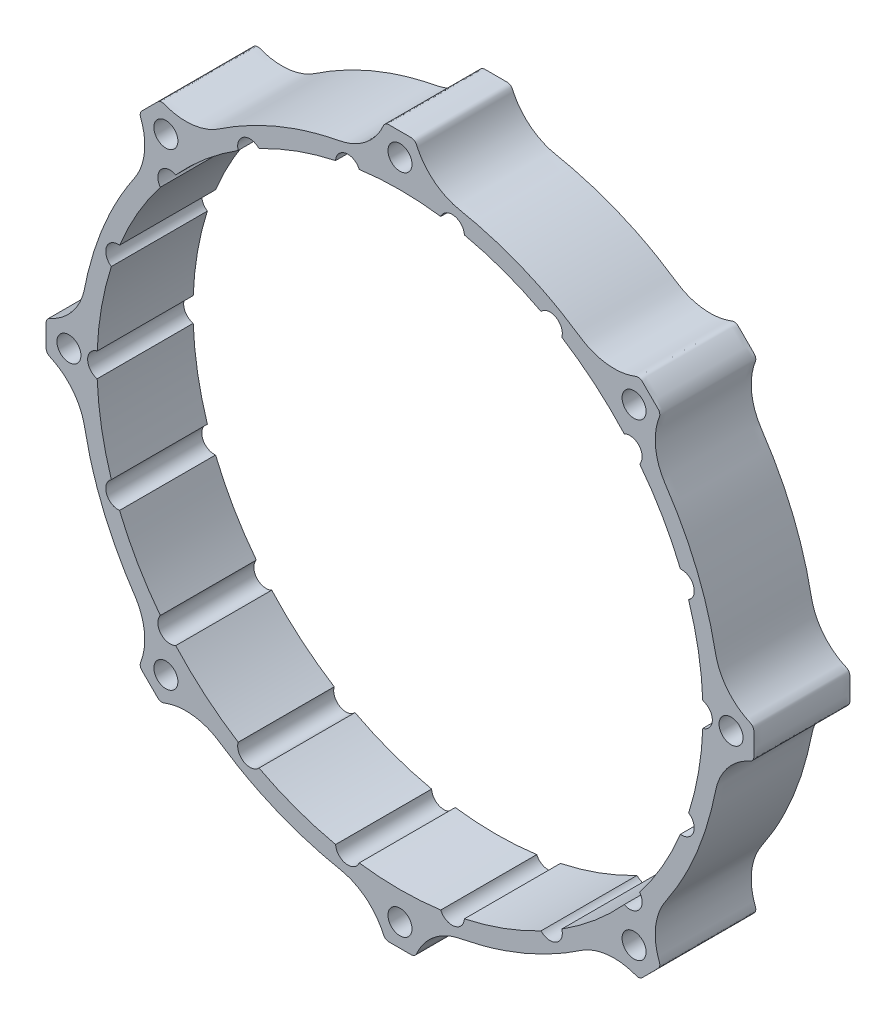
from build123d import *

# Parameters (mm, degrees)
BOSS_EXTRUDE1_DEPTH             = 16
F_4_0MM_DOWEL_HOLE1_D           = 4
F_4_0MM_DOWEL_HOLE1_CSINK_D     = 4.05
F_4_0MM_DOWEL_HOLE1_CSINK_ANGLE = 90
CIRPATTERN1_COUNT               = 8


with BuildPart() as part:
    # Sketch1 → Boss-Extrude1 (new body)
    with BuildSketch(Plane.XY):
        with BuildLine():
            add(Edge.make_bspline(
                [(2.888569338, 58.090305414), (2.86043616, 58.149718786), (2.805341513, 58.269100351), (2.727304111, 58.453248868), (2.652227716, 58.561956296), (2.609742987, 58.612120747), (2.483296792, 58.761423899), (2.319504695, 58.868438946), (2.131986062, 58.924267553), (2.101278346, 58.933409946), (2.038984153, 58.948743127), (1.942760285, 58.965842714), (1.878680735, 58.965842714), (1.84664096, 58.965842714), (1.814601185, 58.965842714), (1.750521635, 58.965842714), (1.654402311, 58.965842714), (1.590322761, 58.965842714), (1.558282986, 58.965842714), (0.519427662, 58.965842714), (-0.519427662, 58.965842714), (-1.558282986, 58.965842714), (-1.590322761, 58.965842714), (-1.654402311, 58.965842714), (-1.750521635, 58.965842714), (-1.814601185, 58.965842714), (-1.84664096, 58.965842714), (-1.878680735, 58.965842714), (-1.942760285, 58.965842714), (-2.038984153, 58.948743127), (-2.101278346, 58.933409946), (-2.131986062, 58.924267553), (-2.319504695, 58.868438946), (-2.483296792, 58.761423899), (-2.609742987, 58.612120747), (-2.652227716, 58.561956296), (-2.727304111, 58.453248868), (-2.805341513, 58.269100351), (-2.86043616, 58.149718786), (-2.888569338, 58.090305414), (-3.904277799, 55.9452699), (-5.591838924, 54.27644442), (-7.748079959, 53.284746062), (-8.235225684, 53.060698004), (-9.245557382, 52.690963884), (-10.84227328, 52.398071486), (-11.889156148, 52.164983222), (-12.410727624, 52.040597997), (-17.936005436, 50.722920633), (-23.183850069, 48.549192213), (-28.022550078, 45.573969403), (-28.479310442, 45.293116312), (-29.384386709, 44.717676629), (-30.720541549, 43.79573419), (-31.696395448, 43.342763299), (-32.199285394, 43.156725154), (-34.52028494, 42.298099023), (-36.994919588, 42.319571853), (-39.300669877, 43.218345087), (-39.301071956, 43.218501816), (-39.301876093, 43.218815326), (-39.303082259, 43.219285695), (-39.303886294, 43.219599465), (-39.304288312, 43.21975635), (-39.304689349, 43.219912852), (-39.305491422, 43.220225856), (-39.306694532, 43.220695362), (-39.307496605, 43.221008367), (-39.307897642, 43.221164869), (-39.310303861, 43.222103881), (-39.31271008, 43.223042894), (-39.3151163, 43.223981906), (-39.315517337, 43.224138408), (-39.31631941, 43.224451412), (-39.317522519, 43.224920919), (-39.318324593, 43.225233923), (-39.318725629, 43.225390425), (-39.319128068, 43.225547474), (-39.319932946, 43.225861573), (-39.321141382, 43.226329852), (-39.321947274, 43.226641342), (-39.32235032, 43.226796825), (-39.599832465, 43.333841276), (-39.896638588, 43.314841774), (-40.158207362, 43.173290965), (-40.186385644, 43.158041979), (-40.241276486, 43.124835529), (-40.32140827, 43.068886213), (-40.366719354, 43.023575129), (-40.389374896, 43.000919586), (-40.412030438, 42.978264044), (-40.457341522, 42.93295296), (-40.525308148, 42.864986334), (-40.570619233, 42.81967525), (-40.593274775, 42.797019708), (-41.327856419, 42.062438063), (-42.062438063, 41.327856419), (-42.797019708, 40.593274775), (-42.81967525, 40.570619233), (-42.864986334, 40.525308148), (-42.93295296, 40.457341522), (-42.978264044, 40.412030438), (-43.000919586, 40.389374896), (-43.023575129, 40.366719354), (-43.068886213, 40.32140827), (-43.124835529, 40.241276486), (-43.158041979, 40.186385644), (-43.173290965, 40.158207362), (-43.314841774, 39.896638588), (-43.333841276, 39.599832465), (-43.226796825, 39.32235032), (-43.226641342, 39.321947274), (-43.226329852, 39.321141382), (-43.225861573, 39.319932946), (-43.225547474, 39.319128068), (-43.225390425, 39.318725629), (-43.225233923, 39.318324593), (-43.224920919, 39.317522519), (-43.224451412, 39.31631941), (-43.224138408, 39.315517337), (-43.223981906, 39.3151163), (-43.223042894, 39.31271008), (-43.222103881, 39.310303861), (-43.221164869, 39.307897642), (-43.221008367, 39.307496605), (-43.220695362, 39.306694532), (-43.220225856, 39.305491422), (-43.219912852, 39.304689349), (-43.21975635, 39.304288312), (-43.219599465, 39.303886294), (-43.219285695, 39.303082259), (-43.218815326, 39.301876093), (-43.218501816, 39.301071956), (-43.218345087, 39.300669877), (-42.319571853, 36.994919588), (-42.298099023, 34.52028494), (-43.156725154, 32.199285394), (-43.342763299, 31.696395448), (-43.79573419, 30.720541549), (-44.717676629, 29.384386709), (-45.293116312, 28.479310442), (-45.573969403, 28.022550078), (-48.549192213, 23.183850069), (-50.722920633, 17.936005436), (-52.040597997, 12.410727624), (-52.164983222, 11.889156148), (-52.398071486, 10.84227328), (-52.690963884, 9.245557382), (-53.060698004, 8.235225684), (-53.284746062, 7.748079959), (-54.31880022, 5.499745081), (-56.083814744, 3.765097724), (-58.349755058, 2.770214708), (-58.350150195, 2.770041219), (-58.350940491, 2.769694293), (-58.35212598, 2.769174006), (-58.352916388, 2.768827336), (-58.353311592, 2.768654001), (-58.353705831, 2.768481089), (-58.35449431, 2.768135265), (-58.355677028, 2.767616529), (-58.356465507, 2.767270705), (-58.356859746, 2.767097793), (-58.359225182, 2.766060321), (-58.361590618, 2.765022849), (-58.363956055, 2.763985377), (-58.364350294, 2.763812465), (-58.365138773, 2.763466641), (-58.366321491, 2.762947905), (-58.367109969, 2.762602081), (-58.367504209, 2.762429169), (-58.367899827, 2.762255652), (-58.368691063, 2.761908619), (-58.36987668, 2.761385249), (-58.370666787, 2.761035654), (-58.371061728, 2.7608606), (-58.642963091, 2.640342951), (-58.839402036, 2.417034653), (-58.924267553, 2.131986062), (-58.933409946, 2.101278346), (-58.948743127, 2.038984153), (-58.965842714, 1.942760285), (-58.965842714, 1.878680735), (-58.965842714, 1.84664096), (-58.965842714, 1.814601185), (-58.965842714, 1.750521635), (-58.965842714, 1.654402311), (-58.965842714, 1.590322761), (-58.965842714, 1.558282986), (-58.965842714, 0.519427662), (-58.965842714, -0.519427662), (-58.965842714, -1.558282986), (-58.965842714, -1.590322761), (-58.965842714, -1.654402311), (-58.965842714, -1.750521635), (-58.965842714, -1.814601185), (-58.965842714, -1.84664096), (-58.965842714, -1.878680735), (-58.965842714, -1.942760285), (-58.948743127, -2.038984153), (-58.933409946, -2.101278346), (-58.924267553, -2.131986062), (-58.839402036, -2.417034653), (-58.642963091, -2.640342951), (-58.371061728, -2.7608606), (-58.370666787, -2.761035654), (-58.36987668, -2.761385249), (-58.368691063, -2.761908619), (-58.367899827, -2.762255652), (-58.367504209, -2.762429169), (-58.367109969, -2.762602081), (-58.366321491, -2.762947905), (-58.365138773, -2.763466641), (-58.364350294, -2.763812465), (-58.363956055, -2.763985377), (-58.361590618, -2.765022849), (-58.359225182, -2.766060321), (-58.356859746, -2.767097793), (-58.356465507, -2.767270705), (-58.355677028, -2.767616529), (-58.35449431, -2.768135265), (-58.353705831, -2.768481089), (-58.353311592, -2.768654001), (-58.352916388, -2.768827336), (-58.35212598, -2.769174006), (-58.350940491, -2.769694293), (-58.350150195, -2.770041219), (-58.349755058, -2.770214708), (-56.083814744, -3.765097724), (-54.31880022, -5.499745081), (-53.284746062, -7.748079959), (-53.060698004, -8.235225684), (-52.690963884, -9.245557382), (-52.398071486, -10.84227328), (-52.164983222, -11.889156148), (-52.040597997, -12.410727624), (-50.722920633, -17.936005436), (-48.549192213, -23.183850069), (-45.573969403, -28.022550078), (-45.293116312, -28.479310442), (-44.717676629, -29.384386709), (-43.79573419, -30.720541549), (-43.342763299, -31.696395448), (-43.156725154, -32.199285394), (-42.298099023, -34.52028494), (-42.319571853, -36.994919588), (-43.218345087, -39.300669877), (-43.218501816, -39.301071956), (-43.218815326, -39.301876093), (-43.219285695, -39.303082259), (-43.219599465, -39.303886294), (-43.21975635, -39.304288312), (-43.219912852, -39.304689349), (-43.220225856, -39.305491422), (-43.220695362, -39.306694532), (-43.221008367, -39.307496605), (-43.221164869, -39.307897642), (-43.222103881, -39.310303861), (-43.223042894, -39.31271008), (-43.223981906, -39.3151163), (-43.224138408, -39.315517337), (-43.224451412, -39.31631941), (-43.224920919, -39.317522519), (-43.225233923, -39.318324593), (-43.225390425, -39.318725629), (-43.225547474, -39.319128068), (-43.225861573, -39.319932946), (-43.226329852, -39.321141382), (-43.226641342, -39.321947274), (-43.226796825, -39.32235032), (-43.333841276, -39.599832465), (-43.314841774, -39.896638588), (-43.173290965, -40.158207362), (-43.158041979, -40.186385644), (-43.124835529, -40.241276486), (-43.068886213, -40.32140827), (-43.023575129, -40.366719354), (-43.000919586, -40.389374896), (-42.978264044, -40.412030438), (-42.93295296, -40.457341522), (-42.864986334, -40.525308148), (-42.81967525, -40.570619233), (-42.797019708, -40.593274775), (-42.062438063, -41.327856419), (-41.327856419, -42.062438063), (-40.593274775, -42.797019708), (-40.570619233, -42.81967525), (-40.525308148, -42.864986334), (-40.457341522, -42.93295296), (-40.412030438, -42.978264044), (-40.389374896, -43.000919586), (-40.366719354, -43.023575129), (-40.32140827, -43.068886213), (-40.241276486, -43.124835529), (-40.186385644, -43.158041979), (-40.158207362, -43.173290965), (-39.896638588, -43.314841774), (-39.599832465, -43.333841276), (-39.32235032, -43.226796825), (-39.321947274, -43.226641342), (-39.321141382, -43.226329852), (-39.319932946, -43.225861573), (-39.319128068, -43.225547474), (-39.318725629, -43.225390425), (-39.318324593, -43.225233923), (-39.317522519, -43.224920919), (-39.31631941, -43.224451412), (-39.315517337, -43.224138408), (-39.3151163, -43.223981906), (-39.31271008, -43.223042894), (-39.310303861, -43.222103881), (-39.307897642, -43.221164869), (-39.307496605, -43.221008367), (-39.306694532, -43.220695362), (-39.305491422, -43.220225856), (-39.304689349, -43.219912852), (-39.304288312, -43.21975635), (-39.303886294, -43.219599465), (-39.303082259, -43.219285695), (-39.301876093, -43.218815326), (-39.301071956, -43.218501816), (-39.300669877, -43.218345087), (-36.994919588, -42.319571853), (-34.52028494, -42.298099023), (-32.199285394, -43.156725154), (-31.696395448, -43.342763299), (-30.720541549, -43.79573419), (-29.384386709, -44.717676629), (-28.479310442, -45.293116312), (-28.022550078, -45.573969403), (-23.183850069, -48.549192213), (-17.936005436, -50.722920633), (-12.410727624, -52.040597997), (-11.889156148, -52.164983222), (-10.84227328, -52.398071486), (-9.245557382, -52.690963884), (-8.235225684, -53.060698004), (-7.748079959, -53.284746062), (-5.499745081, -54.31880022), (-3.765097724, -56.083814744), (-2.770214708, -58.349755058), (-2.770041219, -58.350150195), (-2.769694293, -58.350940491), (-2.769174006, -58.35212598), (-2.768827336, -58.352916388), (-2.768654001, -58.353311592), (-2.768481089, -58.353705831), (-2.768135265, -58.35449431), (-2.767616529, -58.355677028), (-2.767270705, -58.356465507), (-2.767097793, -58.356859746), (-2.766060321, -58.359225182), (-2.765022849, -58.361590618), (-2.763985377, -58.363956055), (-2.763812465, -58.364350294), (-2.763466641, -58.365138773), (-2.762947905, -58.366321491), (-2.762602081, -58.367109969), (-2.762429169, -58.367504209), (-2.762255652, -58.367899827), (-2.761908619, -58.368691063), (-2.761385249, -58.36987668), (-2.761035654, -58.370666787), (-2.7608606, -58.371061728), (-2.640342951, -58.642963091), (-2.417034653, -58.839402036), (-2.131986062, -58.924267553), (-2.101278346, -58.933409946), (-2.038984153, -58.948743127), (-1.942760285, -58.965842714), (-1.878680735, -58.965842714), (-1.84664096, -58.965842714), (-1.814601185, -58.965842714), (-1.750521635, -58.965842714), (-1.654402311, -58.965842714), (-1.590322761, -58.965842714), (-1.558282986, -58.965842714), (-0.519427662, -58.965842714), (0.519427662, -58.965842714), (1.558282986, -58.965842714), (1.590322761, -58.965842714), (1.654402311, -58.965842714), (1.750521635, -58.965842714), (1.814601185, -58.965842714), (1.84664096, -58.965842714), (1.878680735, -58.965842714), (1.942760285, -58.965842714), (2.038984153, -58.948743127), (2.101278346, -58.933409946), (2.131986062, -58.924267553), (2.417034653, -58.839402036), (2.640342951, -58.642963091), (2.7608606, -58.371061728), (2.761035654, -58.370666787), (2.761385249, -58.36987668), (2.761908619, -58.368691063), (2.762255652, -58.367899827), (2.762429169, -58.367504209), (2.762602081, -58.367109969), (2.762947905, -58.366321491), (2.763466641, -58.365138773), (2.763812465, -58.364350294), (2.763985377, -58.363956055), (2.765022849, -58.361590618), (2.766060321, -58.359225182), (2.767097793, -58.356859746), (2.767270705, -58.356465507), (2.767616529, -58.355677028), (2.768135265, -58.35449431), (2.768481089, -58.353705831), (2.768654001, -58.353311592), (2.768827336, -58.352916388), (2.769174006, -58.35212598), (2.769694293, -58.350940491), (2.770041219, -58.350150195), (2.770214708, -58.349755058), (3.765097724, -56.083814744), (5.499745081, -54.31880022), (7.748079959, -53.284746062), (8.235225684, -53.060698004), (9.245557382, -52.690963884), (10.84227328, -52.398071486), (11.889156148, -52.164983222), (12.410727624, -52.040597997), (17.936005436, -50.722920633), (23.183850069, -48.549192213), (28.022550078, -45.573969403), (28.479310442, -45.293116312), (29.384386709, -44.717676629), (30.720541549, -43.79573419), (31.696395448, -43.342763299), (32.199285394, -43.156725154), (34.52028494, -42.298099023), (36.994919588, -42.319571853), (39.300669877, -43.218345087), (39.301071956, -43.218501816), (39.301876093, -43.218815326), (39.303082259, -43.219285695), (39.303886294, -43.219599465), (39.304288312, -43.21975635), (39.304689349, -43.219912852), (39.305491422, -43.220225856), (39.306694532, -43.220695362), (39.307496605, -43.221008367), (39.307897642, -43.221164869), (39.310303861, -43.222103881), (39.31271008, -43.223042894), (39.3151163, -43.223981906), (39.315517337, -43.224138408), (39.31631941, -43.224451412), (39.317522519, -43.224920919), (39.318324593, -43.225233923), (39.318725629, -43.225390425), (39.319128068, -43.225547474), (39.319932946, -43.225861573), (39.321141382, -43.226329852), (39.321947274, -43.226641342), (39.32235032, -43.226796825), (39.599832465, -43.333841276), (39.896638588, -43.314841774), (40.158207362, -43.173290965), (40.186385644, -43.158041979), (40.241276486, -43.124835529), (40.32140827, -43.068886213), (40.366719354, -43.023575129), (40.389374896, -43.000919586), (40.412030438, -42.978264044), (40.457341522, -42.93295296), (40.525308148, -42.864986334), (40.570619233, -42.81967525), (40.593274775, -42.797019708), (41.327856419, -42.062438063), (42.062438063, -41.327856419), (42.797019708, -40.593274775), (42.81967525, -40.570619233), (42.864986334, -40.525308148), (42.93295296, -40.457341522), (42.978264044, -40.412030438), (43.000919586, -40.389374896), (43.023575129, -40.366719354), (43.068886213, -40.32140827), (43.124835529, -40.241276486), (43.158041979, -40.186385644), (43.173290965, -40.158207362), (43.314841774, -39.896638588), (43.333841276, -39.599832465), (43.226796825, -39.32235032), (43.226641342, -39.321947274), (43.226329852, -39.321141382), (43.225861573, -39.319932946), (43.225547474, -39.319128068), (43.225390425, -39.318725629), (43.225233923, -39.318324593), (43.224920919, -39.317522519), (43.224451412, -39.31631941), (43.224138408, -39.315517337), (43.223981906, -39.3151163), (43.223042894, -39.31271008), (43.222103881, -39.310303861), (43.221164869, -39.307897642), (43.221008367, -39.307496605), (43.220695362, -39.306694532), (43.220225856, -39.305491422), (43.219912852, -39.304689349), (43.21975635, -39.304288312), (43.219599465, -39.303886294), (43.219285695, -39.303082259), (43.218815326, -39.301876093), (43.218501816, -39.301071956), (43.218345087, -39.300669877), (42.319571853, -36.994919588), (42.298099023, -34.52028494), (43.156725154, -32.199285394), (43.342763299, -31.696395448), (43.79573419, -30.720541549), (44.717676629, -29.384386709), (45.293116312, -28.479310442), (45.573969403, -28.022550078), (48.549192213, -23.183850069), (50.722920633, -17.936005436), (52.040597997, -12.410727624), (52.164983222, -11.889156148), (52.398071486, -10.84227328), (52.690963884, -9.245557382), (53.060698004, -8.235225684), (53.284746062, -7.748079959), (54.31880022, -5.499745081), (56.083814744, -3.765097724), (58.349755058, -2.770214708), (58.350150195, -2.770041219), (58.350940491, -2.769694293), (58.35212598, -2.769174006), (58.352916388, -2.768827336), (58.353311592, -2.768654001), (58.353705831, -2.768481089), (58.35449431, -2.768135265), (58.355677028, -2.767616529), (58.356465507, -2.767270705), (58.356859746, -2.767097793), (58.359225182, -2.766060321), (58.361590618, -2.765022849), (58.363956055, -2.763985377), (58.364350294, -2.763812465), (58.365138773, -2.763466641), (58.366321491, -2.762947905), (58.367109969, -2.762602081), (58.367504209, -2.762429169), (58.367899827, -2.762255652), (58.368691063, -2.761908619), (58.36987668, -2.761385249), (58.370666787, -2.761035654), (58.371061728, -2.7608606), (58.642963091, -2.640342951), (58.839402036, -2.417034653), (58.924267553, -2.131986062), (58.933409946, -2.101278346), (58.948743127, -2.038984153), (58.965842714, -1.942760285), (58.965842714, -1.878680735), (58.965842714, -1.84664096), (58.965842714, -1.814601185), (58.965842714, -1.750521635), (58.965842714, -1.654402311), (58.965842714, -1.590322761), (58.965842714, -1.558282986), (58.965842714, -0.519427662), (58.965842714, 0.519427662), (58.965842714, 1.558282986), (58.965842714, 1.590322761), (58.965842714, 1.654402311), (58.965842714, 1.750521635), (58.965842714, 1.814601185), (58.965842714, 1.84664096), (58.965842714, 1.878680735), (58.965842714, 1.942760285), (58.948743127, 2.038984153), (58.933409946, 2.101278346), (58.924267553, 2.131986062), (58.839402036, 2.417034653), (58.642963091, 2.640342951), (58.371061728, 2.7608606), (58.370666787, 2.761035654), (58.36987668, 2.761385249), (58.368691063, 2.761908619), (58.367899827, 2.762255652), (58.367504209, 2.762429169), (58.367109969, 2.762602081), (58.366321491, 2.762947905), (58.365138773, 2.763466641), (58.364350294, 2.763812465), (58.363956055, 2.763985377), (58.361590618, 2.765022849), (58.359225182, 2.766060321), (58.356859746, 2.767097793), (58.356465507, 2.767270705), (58.355677028, 2.767616529), (58.35449431, 2.768135265), (58.353705831, 2.768481089), (58.353311592, 2.768654001), (58.352916388, 2.768827336), (58.35212598, 2.769174006), (58.350940491, 2.769694293), (58.350150195, 2.770041219), (58.349755058, 2.770214708), (56.083814744, 3.765097724), (54.31880022, 5.499745081), (53.284746062, 7.748079959), (53.060698004, 8.235225684), (52.690963884, 9.245557382), (52.398071486, 10.84227328), (52.164983222, 11.889156148), (52.040597997, 12.410727624), (50.722920633, 17.936005436), (48.549192213, 23.183850069), (45.573969403, 28.022550078), (45.293116312, 28.479310442), (44.717676629, 29.384386709), (43.79573419, 30.720541549), (43.342763299, 31.696395448), (43.156725154, 32.199285394), (42.298099023, 34.52028494), (42.319571853, 36.994919588), (43.218345087, 39.300669877), (43.218501816, 39.301071956), (43.218815326, 39.301876093), (43.219285695, 39.303082259), (43.219599465, 39.303886294), (43.21975635, 39.304288312), (43.219912852, 39.304689349), (43.220225856, 39.305491422), (43.220695362, 39.306694532), (43.221008367, 39.307496605), (43.221164869, 39.307897642), (43.222103881, 39.310303861), (43.223042894, 39.31271008), (43.223981906, 39.3151163), (43.224138408, 39.315517337), (43.224451412, 39.31631941), (43.224920919, 39.317522519), (43.225233923, 39.318324593), (43.225390425, 39.318725629), (43.225547474, 39.319128068), (43.225861573, 39.319932946), (43.226329852, 39.321141382), (43.226641342, 39.321947274), (43.226796825, 39.32235032), (43.333841276, 39.599832465), (43.314841774, 39.896638588), (43.173290965, 40.158207362), (43.158041979, 40.186385644), (43.124835529, 40.241276486), (43.068886213, 40.32140827), (43.023575129, 40.366719354), (43.000919586, 40.389374896), (42.978264044, 40.412030438), (42.93295296, 40.457341522), (42.864986334, 40.525308148), (42.81967525, 40.570619233), (42.797019708, 40.593274775), (42.062438063, 41.327856419), (41.327856419, 42.062438063), (40.593274775, 42.797019708), (40.570619233, 42.81967525), (40.525308148, 42.864986334), (40.457341522, 42.93295296), (40.412030438, 42.978264044), (40.389374896, 43.000919586), (40.366719354, 43.023575129), (40.32140827, 43.068886213), (40.241276486, 43.124835529), (40.186385644, 43.158041979), (40.158207362, 43.173290965), (39.896638588, 43.314841774), (39.599832465, 43.333841276), (39.32235032, 43.226796825), (39.321947274, 43.226641342), (39.321141382, 43.226329852), (39.319932946, 43.225861573), (39.319128068, 43.225547474), (39.318725629, 43.225390425), (39.318324593, 43.225233923), (39.317522519, 43.224920919), (39.31631941, 43.224451412), (39.315517337, 43.224138408), (39.3151163, 43.223981906), (39.31271008, 43.223042894), (39.310303861, 43.222103881), (39.307897642, 43.221164869), (39.307496605, 43.221008367), (39.306694532, 43.220695362), (39.305491422, 43.220225856), (39.304689349, 43.219912852), (39.304288312, 43.21975635), (39.303886295, 43.219599465), (39.303082259, 43.219285695), (39.301876093, 43.218815326), (39.301071956, 43.218501816), (39.300669877, 43.218345087), (36.994919588, 42.319571853), (34.52028494, 42.298099023), (32.199285394, 43.156725154), (31.696395448, 43.342763299), (30.720541549, 43.79573419), (29.384386709, 44.717676629), (28.479310442, 45.293116312), (28.022550078, 45.573969403), (23.183850069, 48.549192213), (17.936005436, 50.722920633), (12.410727624, 52.040597997), (11.889156148, 52.164983222), (10.84227328, 52.398071486), (9.245557382, 52.690963884), (8.235225684, 53.060698004), (7.748079959, 53.284746062), (5.591838924, 54.27644442), (3.904277799, 55.9452699), (2.888569338, 58.090305414)],
                knots=[0, 0, 0, 0, 0.00052727, 0.001054541, 0.001581811, 0.001581811, 0.001581811, 0.003107616, 0.003107616, 0.003107616, 0.003364602, 0.003621588, 0.003878574, 0.003878574, 0.003878574, 0.00413556, 0.004392546, 0.004649532, 0.004649532, 0.004649532, 0.012982025, 0.012982025, 0.012982025, 0.013239011, 0.013495997, 0.013752983, 0.013752983, 0.013752983, 0.014009968, 0.014266954, 0.01452394, 0.01452394, 0.01452394, 0.016049745, 0.016049745, 0.016049745, 0.016577016, 0.017104286, 0.017631556, 0.017631556, 0.017631556, 0.035903949, 0.035903949, 0.035903949, 0.040204709, 0.044505469, 0.048806229, 0.048806229, 0.048806229, 0.093985258, 0.093985258, 0.093985258, 0.098286018, 0.102586778, 0.106887539, 0.106887539, 0.106887539, 0.125874611, 0.125874611, 0.125874611, 0.125878073, 0.125881534, 0.125884995, 0.125884995, 0.125884995, 0.125888448, 0.125891901, 0.125895354, 0.125895354, 0.125895354, 0.125916072, 0.125916072, 0.125916072, 0.125919524, 0.125922977, 0.12592643, 0.12592643, 0.12592643, 0.125929895, 0.12593336, 0.125936825, 0.125936825, 0.125936825, 0.128176158, 0.128176158, 0.128176158, 0.128433144, 0.12869013, 0.128947116, 0.128947116, 0.128947116, 0.129204102, 0.129461088, 0.129718073, 0.129718073, 0.129718073, 0.138050566, 0.138050566, 0.138050566, 0.138307552, 0.138564538, 0.138821524, 0.138821524, 0.138821524, 0.13907851, 0.139335496, 0.139592482, 0.139592482, 0.139592482, 0.141831815, 0.141831815, 0.141831815, 0.14183528, 0.141838745, 0.14184221, 0.14184221, 0.14184221, 0.141845663, 0.141849116, 0.141852568, 0.141852568, 0.141852568, 0.141873286, 0.141873286, 0.141873286, 0.141876739, 0.141880192, 0.141883645, 0.141883645, 0.141883645, 0.141887106, 0.141890567, 0.141894029, 0.141894029, 0.141894029, 0.160881101, 0.160881101, 0.160881101, 0.165181861, 0.169482622, 0.173783382, 0.173783382, 0.173783382, 0.218962411, 0.218962411, 0.218962411, 0.223263171, 0.227563931, 0.231864691, 0.231864691, 0.231864691, 0.250851764, 0.250851764, 0.250851764, 0.250855225, 0.250858687, 0.250862148, 0.250862148, 0.250862148, 0.250865601, 0.250869054, 0.250872507, 0.250872507, 0.250872507, 0.250893224, 0.250893224, 0.250893224, 0.250896677, 0.25090013, 0.250903583, 0.250903583, 0.250903583, 0.250907048, 0.250910513, 0.250913978, 0.250913978, 0.250913978, 0.253153311, 0.253153311, 0.253153311, 0.253410297, 0.253667282, 0.253924268, 0.253924268, 0.253924268, 0.254181254, 0.25443824, 0.254695226, 0.254695226, 0.254695226, 0.263027719, 0.263027719, 0.263027719, 0.263284705, 0.263541691, 0.263798677, 0.263798677, 0.263798677, 0.264055663, 0.264312649, 0.264569635, 0.264569635, 0.264569635, 0.266808968, 0.266808968, 0.266808968, 0.266812433, 0.266815897, 0.266819362, 0.266819362, 0.266819362, 0.266822815, 0.266826268, 0.266829721, 0.266829721, 0.266829721, 0.266850439, 0.266850439, 0.266850439, 0.266853892, 0.266857344, 0.266860797, 0.266860797, 0.266860797, 0.266864259, 0.26686772, 0.266871181, 0.266871181, 0.266871181, 0.285858254, 0.285858254, 0.285858254, 0.290159014, 0.294459774, 0.298760535, 0.298760535, 0.298760535, 0.343939564, 0.343939564, 0.343939564, 0.348240324, 0.352541084, 0.356841844, 0.356841844, 0.356841844, 0.375828917, 0.375828917, 0.375828917, 0.375832378, 0.375835839, 0.375839301, 0.375839301, 0.375839301, 0.375842754, 0.375846207, 0.37584966, 0.37584966, 0.37584966, 0.375870377, 0.375870377, 0.375870377, 0.37587383, 0.375877283, 0.375880736, 0.375880736, 0.375880736, 0.375884201, 0.375887666, 0.375891131, 0.375891131, 0.375891131, 0.378130463, 0.378130463, 0.378130463, 0.378387449, 0.378644435, 0.378901421, 0.378901421, 0.378901421, 0.379158407, 0.379415393, 0.379672379, 0.379672379, 0.379672379, 0.388004872, 0.388004872, 0.388004872, 0.388261858, 0.388518844, 0.38877583, 0.38877583, 0.38877583, 0.389032816, 0.389289802, 0.389546788, 0.389546788, 0.389546788, 0.39178612, 0.39178612, 0.39178612, 0.391789585, 0.39179305, 0.391796515, 0.391796515, 0.391796515, 0.391799968, 0.391803421, 0.391806874, 0.391806874, 0.391806874, 0.391827591, 0.391827591, 0.391827591, 0.391831044, 0.391834497, 0.39183795, 0.39183795, 0.39183795, 0.391841411, 0.391844873, 0.391848334, 0.391848334, 0.391848334, 0.410835407, 0.410835407, 0.410835407, 0.415136167, 0.419436927, 0.423737687, 0.423737687, 0.423737687, 0.468916716, 0.468916716, 0.468916716, 0.473217477, 0.477518237, 0.481818997, 0.481818997, 0.481818997, 0.50080607, 0.50080607, 0.50080607, 0.500809531, 0.500812992, 0.500816454, 0.500816454, 0.500816454, 0.500819906, 0.500823359, 0.500826812, 0.500826812, 0.500826812, 0.50084753, 0.50084753, 0.50084753, 0.500850983, 0.500854436, 0.500857888, 0.500857888, 0.500857888, 0.500861353, 0.500864818, 0.500868283, 0.500868283, 0.500868283, 0.503107616, 0.503107616, 0.503107616, 0.503364602, 0.503621588, 0.503878574, 0.503878574, 0.503878574, 0.50413556, 0.504392546, 0.504649532, 0.504649532, 0.504649532, 0.512982025, 0.512982025, 0.512982025, 0.513239011, 0.513495997, 0.513752983, 0.513752983, 0.513752983, 0.514009968, 0.514266954, 0.51452394, 0.51452394, 0.51452394, 0.516763273, 0.516763273, 0.516763273, 0.516766738, 0.516770203, 0.516773668, 0.516773668, 0.516773668, 0.516777121, 0.516780574, 0.516784027, 0.516784027, 0.516784027, 0.516804744, 0.516804744, 0.516804744, 0.516808197, 0.51681165, 0.516815103, 0.516815103, 0.516815103, 0.516818564, 0.516822026, 0.516825487, 0.516825487, 0.516825487, 0.53581256, 0.53581256, 0.53581256, 0.54011332, 0.54441408, 0.54871484, 0.54871484, 0.54871484, 0.593893869, 0.593893869, 0.593893869, 0.598194629, 0.602495389, 0.60679615, 0.60679615, 0.60679615, 0.625783222, 0.625783222, 0.625783222, 0.625786684, 0.625790145, 0.625793606, 0.625793606, 0.625793606, 0.625797059, 0.625800512, 0.625803965, 0.625803965, 0.625803965, 0.625824682, 0.625824682, 0.625824682, 0.625828135, 0.625831588, 0.625835041, 0.625835041, 0.625835041, 0.625838506, 0.625841971, 0.625845436, 0.625845436, 0.625845436, 0.628084769, 0.628084769, 0.628084769, 0.628341755, 0.628598741, 0.628855727, 0.628855727, 0.628855727, 0.629112713, 0.629369699, 0.629626684, 0.629626684, 0.629626684, 0.637959177, 0.637959177, 0.637959177, 0.638216163, 0.638473149, 0.638730135, 0.638730135, 0.638730135, 0.638987121, 0.639244107, 0.639501093, 0.639501093, 0.639501093, 0.641740426, 0.641740426, 0.641740426, 0.641743891, 0.641747356, 0.641750821, 0.641750821, 0.641750821, 0.641754274, 0.641757727, 0.641761179, 0.641761179, 0.641761179, 0.641781897, 0.641781897, 0.641781897, 0.64178535, 0.641788803, 0.641792256, 0.641792256, 0.641792256, 0.641795717, 0.641799178, 0.64180264, 0.64180264, 0.64180264, 0.660789712, 0.660789712, 0.660789712, 0.665090472, 0.669391233, 0.673691993, 0.673691993, 0.673691993, 0.718871022, 0.718871022, 0.718871022, 0.723171782, 0.727472542, 0.731773302, 0.731773302, 0.731773302, 0.750760375, 0.750760375, 0.750760375, 0.750763836, 0.750767298, 0.750770759, 0.750770759, 0.750770759, 0.750774212, 0.750777665, 0.750781118, 0.750781118, 0.750781118, 0.750801835, 0.750801835, 0.750801835, 0.750805288, 0.750808741, 0.750812194, 0.750812194, 0.750812194, 0.750815659, 0.750819124, 0.750822589, 0.750822589, 0.750822589, 0.753061922, 0.753061922, 0.753061922, 0.753318908, 0.753575893, 0.753832879, 0.753832879, 0.753832879, 0.754089865, 0.754346851, 0.754603837, 0.754603837, 0.754603837, 0.76293633, 0.76293633, 0.76293633, 0.763193316, 0.763450302, 0.763707288, 0.763707288, 0.763707288, 0.763964274, 0.76422126, 0.764478246, 0.764478246, 0.764478246, 0.766717579, 0.766717579, 0.766717579, 0.766721043, 0.766724508, 0.766727973, 0.766727973, 0.766727973, 0.766731426, 0.766734879, 0.766738332, 0.766738332, 0.766738332, 0.76675905, 0.76675905, 0.76675905, 0.766762503, 0.766765955, 0.766769408, 0.766769408, 0.766769408, 0.76677287, 0.766776331, 0.766779792, 0.766779792, 0.766779792, 0.785766865, 0.785766865, 0.785766865, 0.790067625, 0.794368385, 0.798669146, 0.798669146, 0.798669146, 0.843848175, 0.843848175, 0.843848175, 0.848148935, 0.852449695, 0.856750455, 0.856750455, 0.856750455, 0.875737528, 0.875737528, 0.875737528, 0.875740989, 0.87574445, 0.875747912, 0.875747912, 0.875747912, 0.875751365, 0.875754818, 0.875758271, 0.875758271, 0.875758271, 0.875778988, 0.875778988, 0.875778988, 0.875782441, 0.875785894, 0.875789347, 0.875789347, 0.875789347, 0.875792812, 0.875796277, 0.875799742, 0.875799742, 0.875799742, 0.878039074, 0.878039074, 0.878039074, 0.87829606, 0.878553046, 0.878810032, 0.878810032, 0.878810032, 0.879067018, 0.879324004, 0.87958099, 0.87958099, 0.87958099, 0.887913483, 0.887913483, 0.887913483, 0.888170469, 0.888427455, 0.888684441, 0.888684441, 0.888684441, 0.888941427, 0.889198413, 0.889455399, 0.889455399, 0.889455399, 0.891694731, 0.891694731, 0.891694731, 0.891698196, 0.891701661, 0.891705126, 0.891705126, 0.891705126, 0.891708579, 0.891712032, 0.891715485, 0.891715485, 0.891715485, 0.891736202, 0.891736202, 0.891736202, 0.891739655, 0.891743108, 0.891746561, 0.891746561, 0.891746561, 0.891750022, 0.891753484, 0.891756945, 0.891756945, 0.891756945, 0.910744018, 0.910744018, 0.910744018, 0.915044778, 0.919345538, 0.923646298, 0.923646298, 0.923646298, 0.968825327, 0.968825327, 0.968825327, 0.973126088, 0.977426848, 0.981727608, 0.981727608, 0.981727608, 1, 1, 1, 1], degree=3, weights=[1, 1, 1, 1, 1, 1, 0.972283226, 0.972283226, 1, 1, 1, 1, 1, 1, 1, 1, 1, 1, 1, 1, 1, 1, 1, 1, 1, 1, 1, 1, 1, 1, 1, 1, 0.972283226, 0.972283226, 1, 1, 1, 1, 1, 1, 0.959868564, 0.959868564, 1, 1, 1, 1, 1, 1, 0.991633934, 0.991633934, 1, 1, 1, 1, 1, 1, 0.956556623, 0.956556623, 1, 1, 1, 1, 1, 1, 1, 1, 1, 1, 1, 1, 1, 1, 1, 1, 1, 1, 1, 1, 1, 1, 1, 1, 0.938723945, 0.938723945, 1, 1, 1, 1, 1, 1, 1, 1, 1, 1, 1, 1, 1, 1, 1, 1, 1, 1, 1, 1, 1, 1, 1, 1, 0.938723945, 0.938723945, 1, 1, 1, 1, 1, 1, 1, 1, 1, 1, 1, 1, 1, 1, 1, 1, 1, 1, 1, 1, 1, 1, 1, 1, 0.956556623, 0.956556623, 1, 1, 1, 1, 1, 1, 0.991633934, 0.991633934, 1, 1, 1, 1, 1, 1, 0.956556623, 0.956556623, 1, 1, 1, 1, 1, 1, 1, 1, 1, 1, 1, 1, 1, 1, 1, 1, 1, 1, 1, 1, 1, 1, 1, 1, 0.938723945, 0.938723945, 1, 1, 1, 1, 1, 1, 1, 1, 1, 1, 1, 1, 1, 1, 1, 1, 1, 1, 1, 1, 1, 1, 1, 1, 0.938723945, 0.938723945, 1, 1, 1, 1, 1, 1, 1, 1, 1, 1, 1, 1, 1, 1, 1, 1, 1, 1, 1, 1, 1, 1, 1, 1, 0.956556623, 0.956556623, 1, 1, 1, 1, 1, 1, 0.991633934, 0.991633934, 1, 1, 1, 1, 1, 1, 0.956556623, 0.956556623, 1, 1, 1, 1, 1, 1, 1, 1, 1, 1, 1, 1, 1, 1, 1, 1, 1, 1, 1, 1, 1, 1, 1, 1, 0.938723945, 0.938723945, 1, 1, 1, 1, 1, 1, 1, 1, 1, 1, 1, 1, 1, 1, 1, 1, 1, 1, 1, 1, 1, 1, 1, 1, 0.938723945, 0.938723945, 1, 1, 1, 1, 1, 1, 1, 1, 1, 1, 1, 1, 1, 1, 1, 1, 1, 1, 1, 1, 1, 1, 1, 1, 0.956556623, 0.956556623, 1, 1, 1, 1, 1, 1, 0.991633934, 0.991633934, 1, 1, 1, 1, 1, 1, 0.956556623, 0.956556623, 1, 1, 1, 1, 1, 1, 1, 1, 1, 1, 1, 1, 1, 1, 1, 1, 1, 1, 1, 1, 1, 1, 1, 1, 0.938723945, 0.938723945, 1, 1, 1, 1, 1, 1, 1, 1, 1, 1, 1, 1, 1, 1, 1, 1, 1, 1, 1, 1, 1, 1, 1, 1, 0.938723945, 0.938723945, 1, 1, 1, 1, 1, 1, 1, 1, 1, 1, 1, 1, 1, 1, 1, 1, 1, 1, 1, 1, 1, 1, 1, 1, 0.956556623, 0.956556623, 1, 1, 1, 1, 1, 1, 0.991633934, 0.991633934, 1, 1, 1, 1, 1, 1, 0.956556623, 0.956556623, 1, 1, 1, 1, 1, 1, 1, 1, 1, 1, 1, 1, 1, 1, 1, 1, 1, 1, 1, 1, 1, 1, 1, 1, 0.938723945, 0.938723945, 1, 1, 1, 1, 1, 1, 1, 1, 1, 1, 1, 1, 1, 1, 1, 1, 1, 1, 1, 1, 1, 1, 1, 1, 0.938723945, 0.938723945, 1, 1, 1, 1, 1, 1, 1, 1, 1, 1, 1, 1, 1, 1, 1, 1, 1, 1, 1, 1, 1, 1, 1, 1, 0.956556623, 0.956556623, 1, 1, 1, 1, 1, 1, 0.991633934, 0.991633934, 1, 1, 1, 1, 1, 1, 0.956556623, 0.956556623, 1, 1, 1, 1, 1, 1, 1, 1, 1, 1, 1, 1, 1, 1, 1, 1, 1, 1, 1, 1, 1, 1, 1, 1, 0.938723945, 0.938723945, 1, 1, 1, 1, 1, 1, 1, 1, 1, 1, 1, 1, 1, 1, 1, 1, 1, 1, 1, 1, 1, 1, 1, 1, 0.938723945, 0.938723945, 1, 1, 1, 1, 1, 1, 1, 1, 1, 1, 1, 1, 1, 1, 1, 1, 1, 1, 1, 1, 1, 1, 1, 1, 0.956556623, 0.956556623, 1, 1, 1, 1, 1, 1, 0.991633934, 0.991633934, 1, 1, 1, 1, 1, 1, 0.956556623, 0.956556623, 1, 1, 1, 1, 1, 1, 1, 1, 1, 1, 1, 1, 1, 1, 1, 1, 1, 1, 1, 1, 1, 1, 1, 1, 0.938723945, 0.938723945, 1, 1, 1, 1, 1, 1, 1, 1, 1, 1, 1, 1, 1, 1, 1, 1, 1, 1, 1, 1, 1, 1, 1, 1, 0.938723945, 0.938723945, 1, 1, 1, 1, 1, 1, 1, 1, 1, 1, 1, 1, 1, 1, 1, 1, 1, 1, 1, 1, 1, 1, 1, 1, 0.956556623, 0.956556623, 1, 1, 1, 1, 1, 1, 0.991633934, 0.991633934, 1, 1, 1, 1, 1, 1, 0.959868564, 0.959868564, 1]))
        make_face()
        with BuildLine():
            ThreePointArc((-6.795103507, 50.040749078), (-9.038387648, 51.259243544), (-10.729635549, 49.346984923))
            ThreePointArc((-10.729635549, 49.346984923), (-17.272017238, 47.45447735), (-23.500252795, 44.698860372))
            ThreePointArc((-23.500252795, 44.698860372), (-26.025, 45.076622267), (-26.960222205, 42.701246102))
            ThreePointArc((-26.960222205, 42.701246102), (-32.460774289, 38.685244378), (-37.370924769, 33.96562942))
            ThreePointArc((-37.370924769, 33.96562942), (-39.872613264, 33.457095084), (-39.939008173, 30.905106797))
            ThreePointArc((-39.939008173, 30.905106797), (-43.734282891, 25.25), (-46.73411168, 19.135642281))
            ThreePointArc((-46.73411168, 19.135642281), (-48.911000912, 17.80214846), (-48.100560318, 15.381355502))
            ThreePointArc((-48.100560318, 15.381355502), (-49.732791527, 8.769232972), (-50.460475, 1.997614271))
            ThreePointArc((-50.460475, 1.997614271), (-52.05, 0), (-50.460475, -1.997614271))
            ThreePointArc((-50.460475, -1.997614271), (-49.732791527, -8.769232972), (-48.100560318, -15.381355502))
            ThreePointArc((-48.100560318, -15.381355502), (-48.911000912, -17.80214846), (-46.73411168, -19.135642281))
            ThreePointArc((-46.73411168, -19.135642281), (-43.734282891, -25.25), (-39.939008173, -30.905106797))
            ThreePointArc((-39.939008173, -30.905106797), (-39.872613264, -33.457095084), (-37.370924769, -33.96562942))
            ThreePointArc((-37.370924769, -33.96562942), (-32.460774289, -38.685244378), (-26.960222205, -42.701246102))
            ThreePointArc((-26.960222205, -42.701246102), (-26.025, -45.076622267), (-23.500252795, -44.698860372))
            ThreePointArc((-23.500252795, -44.698860372), (-17.272017238, -47.45447735), (-10.729635549, -49.346984923))
            ThreePointArc((-10.729635549, -49.346984923), (-9.038387648, -51.259243544), (-6.795103507, -50.040749078))
            ThreePointArc((-6.795103507, -50.040749078), (0, -50.5), (6.795103507, -50.040749078))
            ThreePointArc((6.795103507, -50.040749078), (9.038387648, -51.259243544), (10.729635549, -49.346984923))
            ThreePointArc((10.729635549, -49.346984923), (17.272017238, -47.45447735), (23.500252795, -44.698860372))
            ThreePointArc((23.500252795, -44.698860372), (26.025, -45.076622267), (26.960222205, -42.701246102))
            ThreePointArc((26.960222205, -42.701246102), (32.460774289, -38.685244378), (37.370924769, -33.96562942))
            ThreePointArc((37.370924769, -33.96562942), (39.872613264, -33.457095084), (39.939008173, -30.905106797))
            ThreePointArc((39.939008173, -30.905106797), (43.734282891, -25.25), (46.73411168, -19.135642281))
            ThreePointArc((46.73411168, -19.135642281), (48.911000912, -17.80214846), (48.100560318, -15.381355502))
            ThreePointArc((48.100560318, -15.381355502), (49.732791527, -8.769232972), (50.460475, -1.997614271))
            ThreePointArc((50.460475, -1.997614271), (52.05, 0), (50.460475, 1.997614271))
            ThreePointArc((50.460475, 1.997614271), (49.732791527, 8.769232972), (48.100560318, 15.381355502))
            ThreePointArc((48.100560318, 15.381355502), (48.911000912, 17.80214846), (46.73411168, 19.135642281))
            ThreePointArc((46.73411168, 19.135642281), (43.734282891, 25.25), (39.939008173, 30.905106797))
            ThreePointArc((39.939008173, 30.905106797), (39.872613264, 33.457095084), (37.370924769, 33.96562942))
            ThreePointArc((37.370924769, 33.96562942), (32.460774289, 38.685244378), (26.960222205, 42.701246102))
            ThreePointArc((26.960222205, 42.701246102), (26.025, 45.076622267), (23.500252795, 44.698860372))
            ThreePointArc((23.500252795, 44.698860372), (17.272017238, 47.45447735), (10.729635549, 49.346984923))
            ThreePointArc((10.729635549, 49.346984923), (9.038387648, 51.259243544), (6.795103507, 50.040749078))
            ThreePointArc((6.795103507, 50.040749078), (0, 50.5), (-6.795103507, 50.040749078))
        make_face(mode=Mode.SUBTRACT)
    extrude(amount=BOSS_EXTRUDE1_DEPTH)

    # Ø4.0mm Dowel Hole1 (through all)
    with Locations(Plane(origin=(0, 0, 0), x_dir=(-1, 0, 0), z_dir=(0, 0, -1))):
        with Locations((0, 55.17)):
            f_4_0mm_dowel_hole1 = CounterSinkHole(F_4_0MM_DOWEL_HOLE1_D / 2, F_4_0MM_DOWEL_HOLE1_CSINK_D / 2, counter_sink_angle=F_4_0MM_DOWEL_HOLE1_CSINK_ANGLE)

    # CirPattern1: Ø4.0mm Dowel Hole1 ×8 about axis
    cirpattern1_axis = Axis((0, 0, 16), (0, 0, -1))
    for i in range(1, CIRPATTERN1_COUNT):
        add(f_4_0mm_dowel_hole1.rotate(cirpattern1_axis, i * 360 / CIRPATTERN1_COUNT), mode=Mode.SUBTRACT)


solid = part.part
